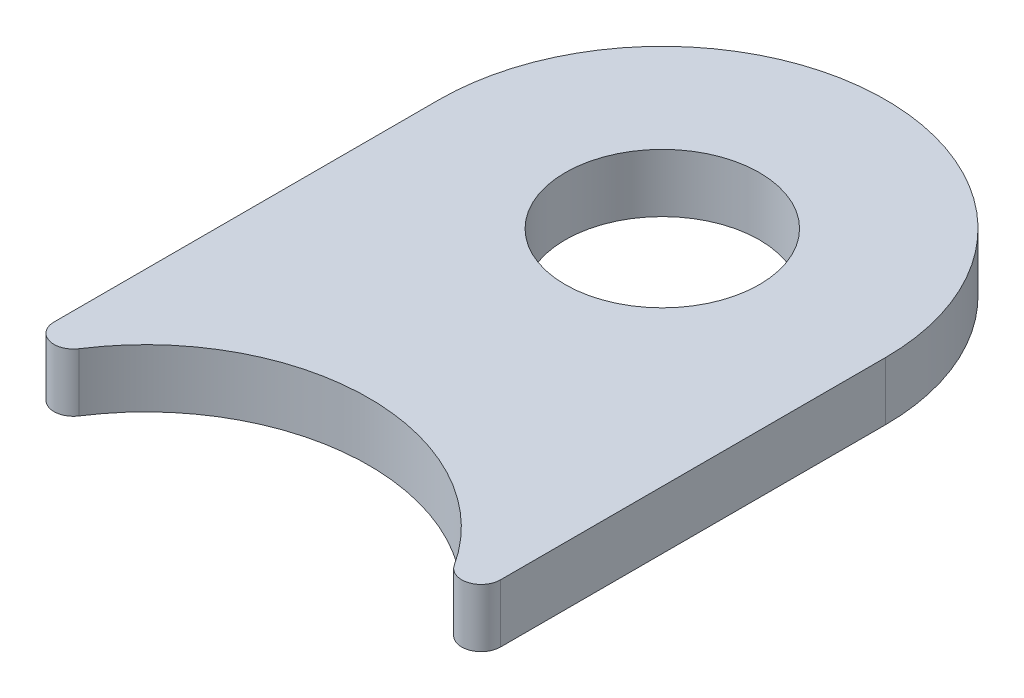
from build123d import *

# Parameters (mm, degrees)
SKETCH1_R           = 5
BOSS_EXTRUDE1_DEPTH = 3
FILLET1_R           = 1


with BuildPart() as part:
    # Sketch1 → Boss-Extrude1 (new body)
    with BuildSketch(Plane(origin=(0, 0, 0), x_dir=(1, 0, 0), z_dir=(0, 1, 0))):
        with BuildLine():
            Line((11.5, 0), (11.5, 26.614580921))
            ThreePointArc((11.5, 26.614580921), (0, 38.114580921), (-11.5, 26.614580921))
            Line((-11.5, 26.614580921), (-11.5, 0))
            ThreePointArc((-11.5, 0), (0, 11.5), (11.5, 0))
        make_face()
        with Locations((0, 26.614580921)):
            Circle(SKETCH1_R, mode=Mode.SUBTRACT)
    extrude(amount=BOSS_EXTRUDE1_DEPTH)

    # Fillet1
    fillet1_edges = [part.edges().sort_by_distance(p)[0] for p in [
        (-11.5, 1.5, 0),
        (11.5, 1.5, 0),
    ]]
    fillet(fillet1_edges, radius=FILLET1_R)


solid = part.part
